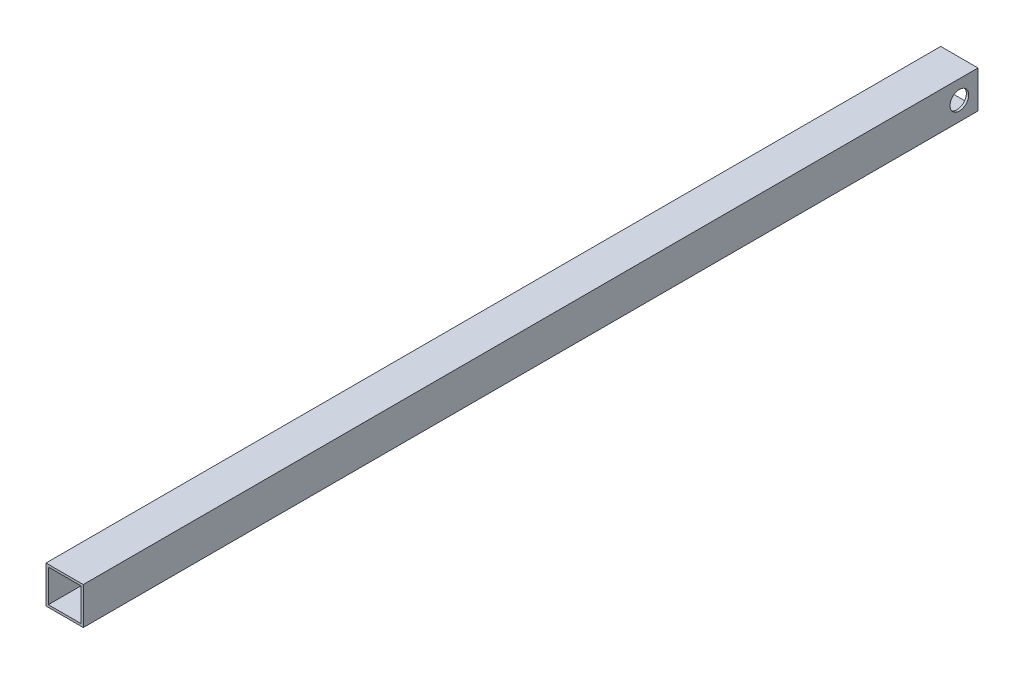
from build123d import *

# Parameters (mm, degrees)
SKETCH2_W                  = 25.4
SKETCH2_H                  = 25.4
SKETCH2_W_2                = 22.225
SKETCH2_H_2                = 22.225
BOSS_EXTRUDE1_DEPTH        = 609.6
F_1_2_0_5_DIAMETER_HOLE1_D = 12.7


with BuildPart() as part:
    # Sketch2 → Boss-Extrude1 (new body)
    with BuildSketch(Plane.XY):
        with Locations((12.7, 12.7)):
            Rectangle(SKETCH2_W, SKETCH2_H)
        with Locations((12.7, 12.7)):
            Rectangle(SKETCH2_W_2, SKETCH2_H_2, mode=Mode.SUBTRACT)
    extrude(amount=BOSS_EXTRUDE1_DEPTH)

    # 1/2 (0.5) Diameter Hole1 (through all)
    with Locations(Plane.ZY):
        with Locations((12.7, 12.7)):
            Hole(F_1_2_0_5_DIAMETER_HOLE1_D / 2)


solid = part.part
